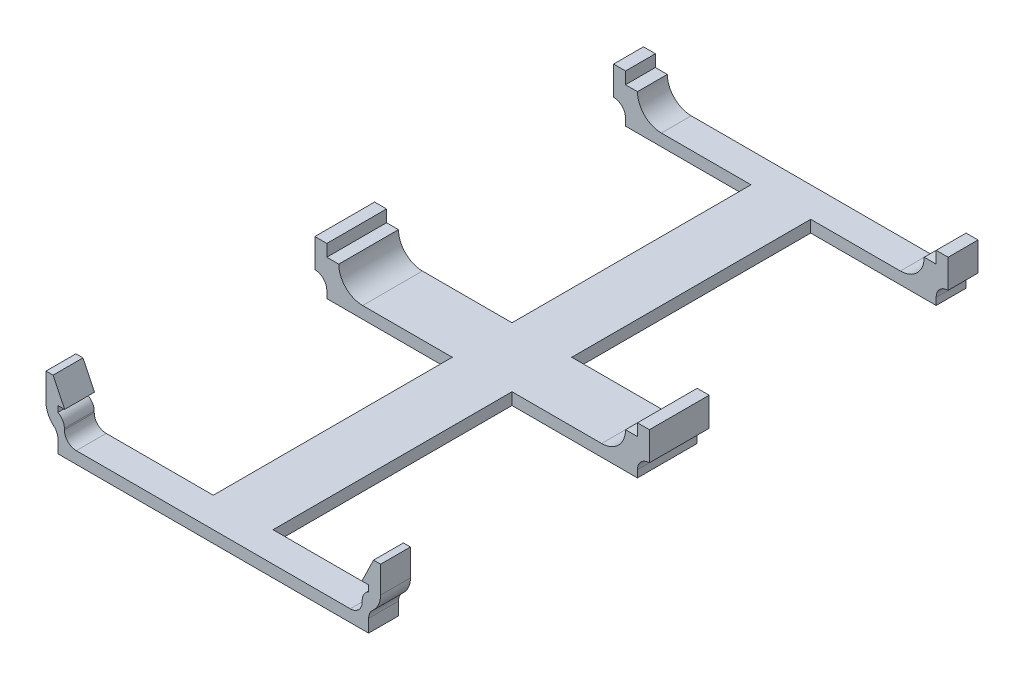
from build123d import *

# Parameters (mm, degrees)
BOSS_EXTRUDE1_DEPTH = 63.5
CUT_EXTRUDE1_REACH  = 72.818
SKETCH2_W           = 14.605
SKETCH2_H           = 25.4
BOSS_EXTRUDE2_DEPTH = 3.175
CUT_EXTRUDE2_REACH  = 72.98
SKETCH4_W           = 0.588974589
SKETCH4_H           = 2.54
FILLET1_R           = 2.38
FILLET2_R           = 1.27
FILLET3_R           = 2.54
FILLET5_R           = 1.27
FILLET6_R           = 1.27


# Some blends are built 0.0001 mm under size
with BuildPart() as part:
    # Sketch1 → Boss-Extrude1 (new body)
    with BuildSketch(Plane.XY):
        Polygon((0, 0), (13.158113026, 0), (13.158113026, 1.27), (-2.081886974, 1.27), (-2.081886974, 3.81), (-3.351886974, 3.81), (-3.351886974, 5.08), (-4.621886974, 5.08), (-4.621886974, 2.032), (-3.351886974, 2.032), (-3.351886974, 0), align=None)
    boss_extrude1 = extrude(amount=-BOSS_EXTRUDE1_DEPTH)

    # Mirror1: Boss-Extrude1 across plane
    add(boss_extrude1.mirror(Plane(origin=(13.158113026, 1.27, -63.5), x_dir=(0, 0, 1), z_dir=(-1, 0, 0))))

    # Cut-Extrude1: up to this face of the body (flat: up to its plane)
    cut_extrude1_end = Plane(part.part.faces().sort_by_distance((13.158113026, 0, -31.75))[0])
    # Sketch2 → Cut-Extrude1 (cut, up to the picked face)
    with BuildSketch(Plane(origin=(0, 5.08, 0), x_dir=(1, 0, 0), z_dir=(0, 1, 0)), mode=Mode.PRIVATE) as cut_extrude1_sk1:
        with Locations((2.680613026, 15.875)):
            Rectangle(SKETCH2_W, SKETCH2_H)
    cut_extrude1_tool1 = split(extrude(cut_extrude1_sk1.sketch, amount=-CUT_EXTRUDE1_REACH, mode=Mode.PRIVATE), bisect_by=cut_extrude1_end, keep=Keep.BOTH, mode=Mode.PRIVATE)
    # Sketch2 → Cut-Extrude1 (cut, up to the picked face)
    with BuildSketch(Plane(origin=(0, 5.08, 0), x_dir=(1, 0, 0), z_dir=(0, 1, 0)), mode=Mode.PRIVATE) as cut_extrude1_sk2:
        with Locations((23.635613026, 15.875)):
            Rectangle(SKETCH2_W, SKETCH2_H)
    cut_extrude1_tool2 = split(extrude(cut_extrude1_sk2.sketch, amount=-CUT_EXTRUDE1_REACH, mode=Mode.PRIVATE), bisect_by=cut_extrude1_end, keep=Keep.BOTH, mode=Mode.PRIVATE)
    # Sketch2 → Cut-Extrude1 (cut, up to the picked face)
    with BuildSketch(Plane(origin=(0, 5.08, 0), x_dir=(1, 0, 0), z_dir=(0, 1, 0)), mode=Mode.PRIVATE) as cut_extrude1_sk3:
        with Locations((2.680613026, 47.625)):
            Rectangle(SKETCH2_W, SKETCH2_H)
    cut_extrude1_tool3 = split(extrude(cut_extrude1_sk3.sketch, amount=-CUT_EXTRUDE1_REACH, mode=Mode.PRIVATE), bisect_by=cut_extrude1_end, keep=Keep.BOTH, mode=Mode.PRIVATE)
    # Sketch2 → Cut-Extrude1 (cut, up to the picked face)
    with BuildSketch(Plane(origin=(0, 5.08, 0), x_dir=(1, 0, 0), z_dir=(0, 1, 0)), mode=Mode.PRIVATE) as cut_extrude1_sk4:
        with Locations((23.635613026, 47.625)):
            Rectangle(SKETCH2_W, SKETCH2_H)
    cut_extrude1_tool4 = split(extrude(cut_extrude1_sk4.sketch, amount=-CUT_EXTRUDE1_REACH, mode=Mode.PRIVATE), bisect_by=cut_extrude1_end, keep=Keep.BOTH, mode=Mode.PRIVATE)
    add(cut_extrude1_tool1.solids().sort_by(Axis((2.680613, 5.08, -15.875), (0, -1, 0)))[0], mode=Mode.SUBTRACT)
    add(cut_extrude1_tool2.solids().sort_by(Axis((23.635613, 5.08, -15.875), (0, -1, 0)))[0], mode=Mode.SUBTRACT)
    add(cut_extrude1_tool3.solids().sort_by(Axis((2.680613, 5.08, -47.625), (0, -1, 0)))[0], mode=Mode.SUBTRACT)
    add(cut_extrude1_tool4.solids().sort_by(Axis((23.635613, 5.08, -47.625), (0, -1, 0)))[0], mode=Mode.SUBTRACT)

    # Sketch3 → Boss-Extrude2 (add)
    with BuildSketch(Plane.XY):
        Polygon((-4.621886974, 4.445), (-2.637712851, 4.445), (-3.870360235, 6.985), (-4.621886974, 6.985), align=None)
    boss_extrude2 = extrude(amount=-BOSS_EXTRUDE2_DEPTH)

    # Mirror2: Boss-Extrude2 across plane
    add(boss_extrude2.mirror(Plane.ZY.offset(-13.158113026)))

    # Sketch4 → Cut-Extrude2 (cut, up to next)
    with BuildSketch(Plane.XY, mode=Mode.PRIVATE) as cut_extrude2_sk1:
        with Locations((-2.376374269, 2.54)):
            Rectangle(SKETCH4_W, SKETCH4_H)
    cut_extrude2_tool1 = extrude(cut_extrude2_sk1.sketch, amount=-CUT_EXTRUDE2_REACH, mode=Mode.PRIVATE) & part.part
    cut_extrude2 = cut_extrude2_tool1.solids().sort_by_distance((-2.376374, 2.54, 0))[0]
    add(cut_extrude2, mode=Mode.SUBTRACT)

    # Mirror3: Cut-Extrude2 across plane
    add(cut_extrude2.mirror(Plane.ZY.offset(-13.158113026)), mode=Mode.SUBTRACT)

    # Fillet1
    # the kernel refuses this fillet: 2.38 mm, written as the material it takes off along each edge
    with BuildSketch(Plane(origin=(30.938113026, 2.032, 5.263257071), x_dir=(0, 1, 0), z_dir=(0, 0, -1))) as fillet1_piece_1:
        with BuildLine():
            CenterArc((2.105302829, -2.38), FILLET1_R, 90, 62.200005552)
            Line((0, -1.27), (-0.042106057, -1.2478))
            ThreePointArc((-0.042106057, -1.2478), (-0.0476, -0.635), (-0.0476, 0))
            Line((-0.0476, 0), (0, 0.0476))
            Line((0, 0.0476), (2.105302829, 0.0476))
            Line((2.105302829, 0.0476), (2.105302829, 0))
        make_face()
    extrude(amount=13.701514143, mode=Mode.SUBTRACT)
    with BuildSketch(Plane(origin=(-4.621886974, 2.032, 5.263257071), x_dir=(1, 0, 0), z_dir=(0, 0, -1))) as fillet1_piece_2:
        with BuildLine():
            CenterArc((2.38, -2.105302829), FILLET1_R, 117.799994448, 62.200005552)
            Line((0, -2.105302829), (-0.0476, -2.105302829))
            Line((-0.0476, -2.105302829), (-0.0476, 0))
            Line((-0.0476, 0), (0, 0.0476))
            ThreePointArc((0, 0.0476), (0.635, 0.0476), (1.2478, 0.042106057))
            Line((1.2478, 0.042106057), (1.27, 0))
        make_face()
    extrude(amount=13.701514143, mode=Mode.SUBTRACT)

    # Fillet2
    # the kernel refuses this fillet: 1.27 mm, written as the material it adds along each edge
    with BuildSketch(Plane(origin=(-3.351886974, 2.032, 0), x_dir=(0, -1, 0), z_dir=(0, 0, -1))) as fillet2_piece_1:
        with BuildLine():
            CenterArc((0.662024402, 1.27), FILLET2_R, 220.696704321, 49.303295679)
            ThreePointArc((-0.30085384, 0.441890411), (-0.137980638, 0.229419053), (0, 0))
            Line((0, 0), (0.662024402, 0))
        make_face()
    extrude(amount=3.175)
    with BuildSketch(Plane(origin=(29.668113026, 2.032, 0), x_dir=(0, -1, 0), z_dir=(0, 0, -1))) as fillet2_piece_2:
        with BuildLine():
            CenterArc((0.662024402, -1.27), FILLET2_R, 90, 49.303295679)
            ThreePointArc((-0.30085384, -0.441890411), (-0.137980638, -0.229419053), (0, 0))
            Line((0, 0), (0.662024402, 0))
        make_face()
    extrude(amount=3.175)
    # the kernel refuses this fillet: 1.27 mm, written as the material it takes off along each edge
    with BuildSketch(Plane(origin=(28.987087615, 3.81, 2.81292656), x_dir=(0, -1, 0), z_dir=(0, 0, -1))) as fillet2_2_piece_1:
        with BuildLine():
            CenterArc((1.125170624, -1.27), FILLET2_R, 90, 62.370030247)
            Line((0, -0.681025411), (0, 0))
            Line((0, 0), (1.125170624, 0))
        make_face()
    extrude(amount=8.800853121, mode=Mode.SUBTRACT)
    with BuildSketch(Plane(origin=(-2.670861563, 3.81, 2.81292656), x_dir=(-1, 0, 0), z_dir=(0, 0, -1))) as fillet2_2_piece_2:
        with BuildLine():
            CenterArc((1.27, -1.125170624), FILLET2_R, 117.629969753, 62.370030247)
            Line((0, -1.125170624), (0, 0))
            Line((0, 0), (0.681025411, 0))
        make_face()
    extrude(amount=8.800853121, mode=Mode.SUBTRACT)

    # Fillet3
    fillet3_edges = [part.edges().sort_by_distance(p)[0] for p in [
        (28.398113026, 1.27, -31.75),
        (28.398113026, 1.27, -61.9125),
        (-2.081886974, 1.27, -61.9125),
        (-2.081886974, 1.27, -31.75),
    ]]
    fillet(fillet3_edges, radius=FILLET3_R - 0.0001)  # a hair under: the kernel refuses the full size

    # Fillet5
    fillet5_edges = [part.edges().sort_by_distance(p)[0] for p in [
        (29.668113026, 2.032, -61.9125),
        (29.668113026, 2.032, -31.75),
        (-3.351886974, 2.032, -61.9125),
        (-3.351886974, 2.032, -31.75),
    ]]
    fillet(fillet5_edges, radius=FILLET5_R - 0.0001)  # a hair under: the kernel refuses the full size

    # Fillet6
    fillet6_edges = [part.edges().sort_by_distance(p)[0] for p in [
        (-2.670861563, 1.27, -1.5875),
        (28.987087615, 1.27, -1.5875),
    ]]
    fillet(fillet6_edges, radius=FILLET6_R)


solid = part.part
